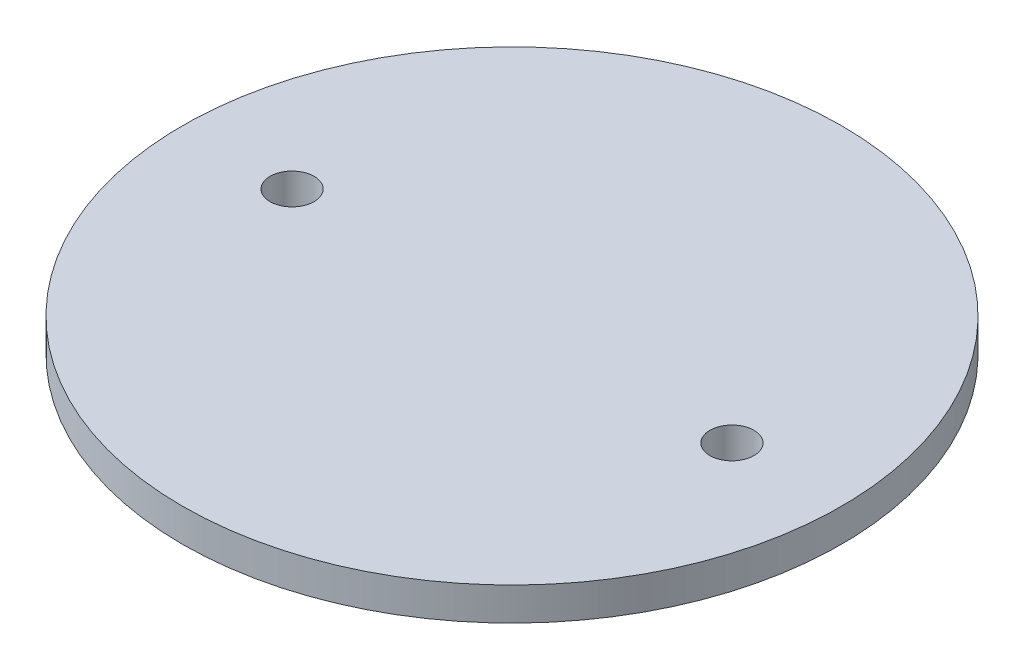
from build123d import *

# Parameters (mm, degrees)
SKETCH1_R           = 47.575
BOSS_EXTRUDE1_DEPTH = 4.7625
SKETCH2_R           = 3.175
CUT_EXTRUDE1_DEPTH  = 68.449556383


with BuildPart() as part:
    # Sketch1 → Boss-Extrude1 (new body)
    with BuildSketch(Plane(origin=(0, 0, 0), x_dir=(1, 0, 0), z_dir=(0, 1, 0))):
        Circle(SKETCH1_R)
    extrude(amount=BOSS_EXTRUDE1_DEPTH)

    # Sketch2 → Cut-Extrude1 (cut, through all)
    with BuildSketch(Plane(origin=(0, 4.7625, 0), x_dir=(1, 0, 0), z_dir=(0, 1, 0))):
        with Locations((31.75, 0)):
            Circle(SKETCH2_R)
        with Locations((-31.75, 0)):
            Circle(SKETCH2_R)
    extrude(amount=-CUT_EXTRUDE1_DEPTH, mode=Mode.SUBTRACT)


solid = part.part
